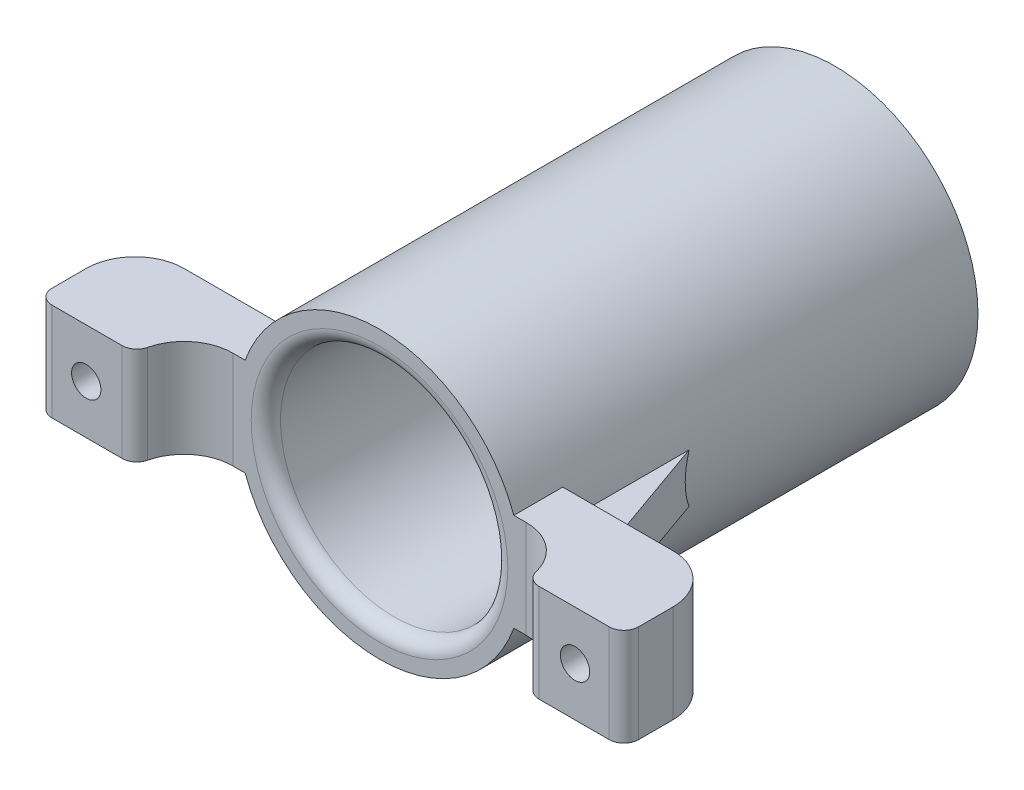
from build123d import *

# Parameters (mm, degrees)
ESQUISSE1_R             = 14.625
ESQUISSE1_R_2           = 11.625
BOSS_EXTRU_1_DEPTH      = 46.6
BOSS_EXTRU_3_START      = -5
BOSS_EXTRU_3_DEPTH      = 5
ESQUISSE3_W             = 10
ESQUISSE3_H             = 10
BOSS_EXTRU_4_DEPTH      = 5
CONG_1_R                = 5
BOSS_EXTRU_6_START      = -2.5
BOSS_EXTRU_6_DEPTH      = 5
CONG_2_R                = 5
ESQUISSE5_R             = 1.5
ENL_V_MAT_EXTRU_1_DEPTH = 62.452832522
CONG_3_R                = 1.5
CONG_4_R                = 1.5


with BuildPart() as part:
    # Esquisse1 → Boss.-Extru.1 (new body)
    with BuildSketch(Plane.XY):
        Circle(ESQUISSE1_R)
        Circle(ESQUISSE1_R_2, mode=Mode.SUBTRACT)
    extrude(amount=BOSS_EXTRU_1_DEPTH)

    # Esquisse2 → Boss.-Extru.3 (add)
    with BuildSketch(Plane.XY.offset(46.6).offset(BOSS_EXTRU_3_START)):
        with BuildLine():
            Line((-30, 5), (-13.743748579, 5))
            ThreePointArc((-13.743748579, 5), (-14.625, 0), (-13.743748579, -5))
            Line((-13.743748579, -5), (-30, -5))
            Line((-30, -5), (-30, 5))
        make_face()
        with BuildLine():
            Line((30, 5), (30, -5))
            Line((30, -5), (13.743748579, -5))
            ThreePointArc((13.743748579, -5), (14.625, 0), (13.743748579, 5))
            Line((13.743748579, 5), (30, 5))
        make_face()
    extrude(amount=BOSS_EXTRU_3_DEPTH)

    # Esquisse3 → Boss.-Extru.4 (add)
    with BuildSketch(Plane.XY.offset(46.6)):
        with Locations((-25, 0)):
            Rectangle(ESQUISSE3_W, ESQUISSE3_H)
        with Locations((25, 0)):
            Rectangle(ESQUISSE3_W, ESQUISSE3_H)
    extrude(amount=BOSS_EXTRU_4_DEPTH)

    # Congé1
    cong_1_edges = [part.edges().sort_by_distance(p)[0] for p in [
        (30, 0, 41.6),
        (-30, 0, 41.6),
    ]]
    fillet(cong_1_edges, radius=CONG_1_R)

    # Esquisse4 → Boss.-Extru.6 (add)
    with BuildSketch(Plane(origin=(0, 5, 0), x_dir=(1, 0, 0), z_dir=(0, 1, 0)).offset(BOSS_EXTRU_6_START)):
        Polygon((-18.743748579, -41.6), (-13.743748579, -41.6), (-13.743748579, -27.457864376), align=None)
        Polygon((13.743748579, -27.457864376), (13.743748579, -41.6), (18.743748579, -41.6), align=None)
    extrude(amount=-BOSS_EXTRU_6_DEPTH)

    # Congé2
    cong_2_edges = [part.edges().sort_by_distance(p)[0] for p in [
        (20, 0, 46.6),
        (-20, 0, 46.6),
    ]]
    fillet(cong_2_edges, radius=CONG_2_R - 0.0001)  # a hair under: the kernel refuses the full size

    # Esquisse5 → Enlèv. mat.-Extru.1 (cut, through all)
    with BuildSketch(Plane.XY.offset(51.6)):
        with Locations((-25, 0)):
            Circle(ESQUISSE5_R)
        with Locations(Location((25, 0, 0), (0, 0, 270))):
            Circle(ESQUISSE5_R)
    extrude(amount=-ENL_V_MAT_EXTRU_1_DEPTH, mode=Mode.SUBTRACT)

    # Congé3
    cong_3_edges = [part.edges().sort_by_distance(p)[0] for p in [
        (-30, 0, 51.6),
        (-20, 0, 51.6),
        (20, 0, 51.6),
        (30, 0, 51.6),
    ]]
    fillet(cong_3_edges, radius=CONG_3_R)

    # Congé4
    cong_4_edges = [part.edges().sort_by_distance(p)[0] for p in [
        (-11.625, 0, 0),
        (-11.625, 0, 46.6),
    ]]
    fillet(cong_4_edges, radius=CONG_4_R)


solid = part.part
